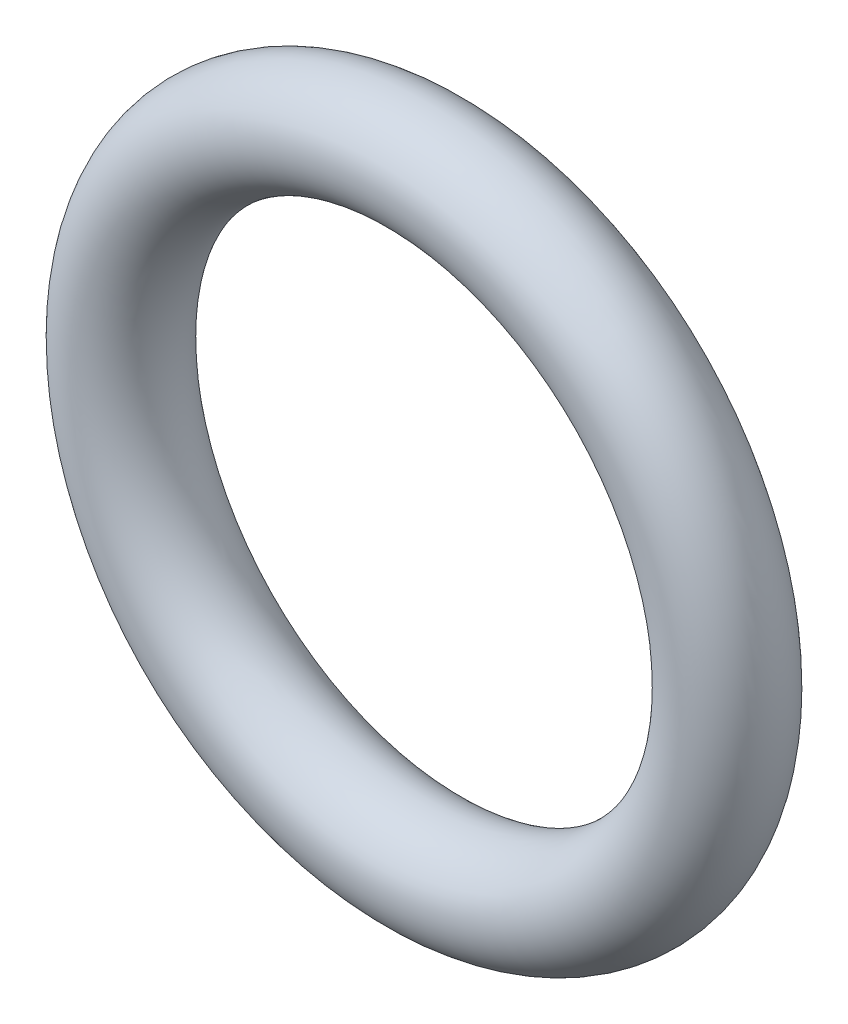
from build123d import *

# Parameters (mm, degrees)
SKETCH1_R = 1.3081


with BuildPart() as part:
    # Sketch1 → Revolve1 (revolve)
    with BuildSketch(Plane(origin=(0, 0, 0), x_dir=(0, -1, 0), z_dir=(1, 0, 0))):
        with Locations((7.493, 0)):
            Circle(SKETCH1_R)
    revolve(axis=Axis((0, 0, 1.3081), (0, 0, -1)))


solid = part.part
